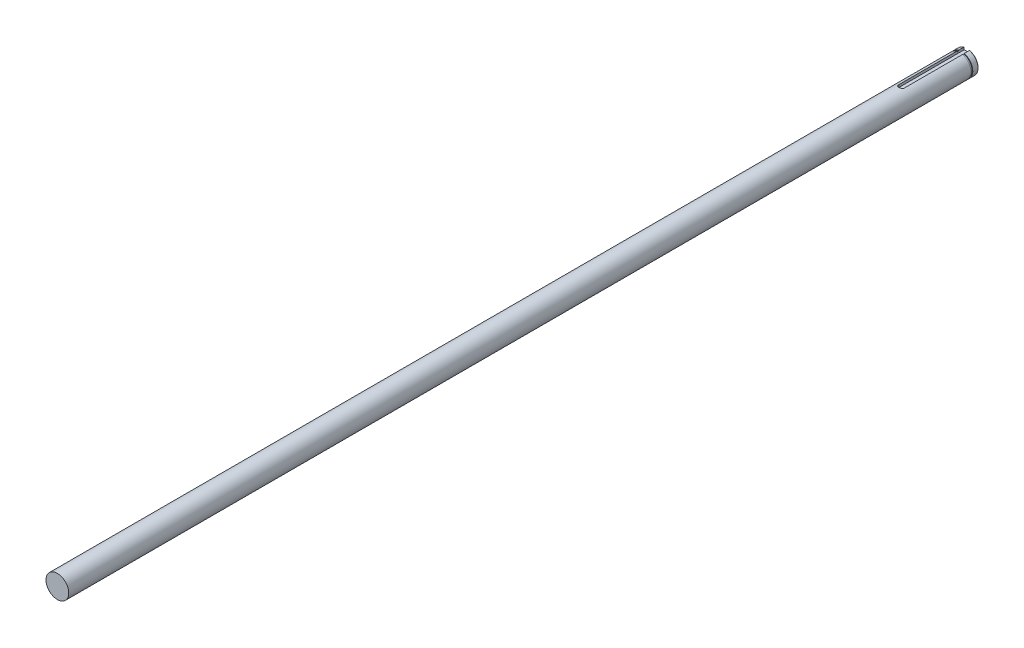
from build123d import *

# Parameters (mm, degrees)
SKETCH1_R           = 6.35
BOSS_EXTRUDE1_DEPTH = 508
SKETCH2_W           = 3.175
SKETCH2_H           = 3.175
CUT_EXTRUDE1_DEPTH  = 38.1
SKETCH3_R           = 9.19467987
SKETCH3_R_2         = 5.9436
CUT_EXTRUDE2_DEPTH  = 0.9906
CHAMFER1_SIZE       = 0.254
FILLET1_R           = 1.5875


with BuildPart() as part:
    # Sketch1 → Boss-Extrude1 (new body)
    with BuildSketch(Plane.XY):
        Circle(SKETCH1_R)
    extrude(amount=BOSS_EXTRUDE1_DEPTH)

    # Sketch2 → Cut-Extrude1 (cut)
    with BuildSketch(Plane(origin=(0, 0, 0), x_dir=(-1, 0, 0), z_dir=(0, 0, -1))):
        with Locations((0, 6.35)):
            Rectangle(SKETCH2_W, SKETCH2_H)
    extrude(amount=-CUT_EXTRUDE1_DEPTH, mode=Mode.SUBTRACT)

    # Sketch3 → Cut-Extrude2 (cut)
    with BuildSketch(Plane(origin=(0, 0, 3.175), x_dir=(-1, 0, 0), z_dir=(0, 0, -1))):
        Circle(SKETCH3_R)
        Circle(SKETCH3_R_2, mode=Mode.SUBTRACT)
    extrude(amount=-CUT_EXTRUDE2_DEPTH, mode=Mode.SUBTRACT)

    # Chamfer1
    chamfer1_edges = [part.edges().sort_by_distance(p)[0] for p in [
        (0, -6.35, 0),
    ]]
    chamfer(chamfer1_edges, length=CHAMFER1_SIZE)

    # Fillet1
    fillet1_edges = [part.edges().sort_by_distance(p)[0] for p in [
        (-1.5875, 5.455430531, 38.1),
        (1.5875, 5.455430531, 38.1),
    ]]
    fillet(fillet1_edges, radius=FILLET1_R - 0.0001)  # a hair under: the kernel refuses the full size


solid = part.part
